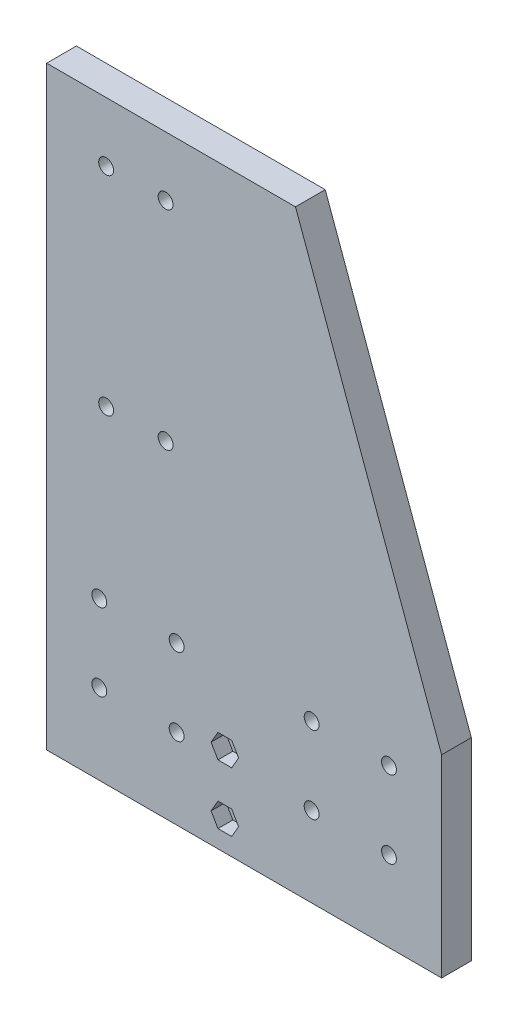
from build123d import *

# Parameters (mm, degrees)
SKETCH1_R           = 2.5
BOSS_EXTRUDE1_DEPTH = 10
CUT_EXTRUDE1_START  = 5
SKETCH1_3_R         = 2.5
CUT_EXTRUDE1_DEPTH  = 5
SKETCH4_R           = 2.5
CUT_EXTRUDE2_DEPTH  = 241.282833344


with BuildPart() as part:
    # Sketch1 → Boss-Extrude1 (new body)
    with BuildSketch(Plane.XY):
        Polygon((0, 200), (0, 0), (132.8, 0), (132.8, 65), (83.664018374, 200), align=None)
        with Locations((17.7, 27)):
            Circle(SKETCH1_R, mode=Mode.SUBTRACT)
        with Locations((43.7, 27)):
            Circle(SKETCH1_R, mode=Mode.SUBTRACT)
        with Locations((17.7, 53)):
            Circle(SKETCH1_R, mode=Mode.SUBTRACT)
        with Locations((43.7, 53)):
            Circle(SKETCH1_R, mode=Mode.SUBTRACT)
        with Locations((89.1, 27)):
            Circle(SKETCH1_R, mode=Mode.SUBTRACT)
        with Locations((115.1, 27)):
            Circle(SKETCH1_R, mode=Mode.SUBTRACT)
        with Locations((89.1, 53)):
            Circle(SKETCH1_R, mode=Mode.SUBTRACT)
        with Locations((115.1, 53)):
            Circle(SKETCH1_R, mode=Mode.SUBTRACT)
        with Locations((59.91, 9.92)):
            Circle(SKETCH1_R, mode=Mode.SUBTRACT)
        with Locations((59.91, 29.92)):
            Circle(SKETCH1_R, mode=Mode.SUBTRACT)
    extrude(amount=BOSS_EXTRUDE1_DEPTH)

    # Sketch1<3> → Cut-Extrude1 (cut)
    # profile 1 of 2: a face of its own
    with BuildSketch(Plane.XY.offset(CUT_EXTRUDE1_START)):
        Polygon((62.2225, 25.914632507), (64.535, 29.92), (62.2225, 33.925367493), (57.5975, 33.925367493), (55.285, 29.92), (57.5975, 25.914632507), align=None)
        with Locations((59.91, 29.92)):
            Circle(SKETCH1_3_R, mode=Mode.SUBTRACT)
    # profile 2 of 2: a face of its own
    with BuildSketch(Plane.XY.offset(CUT_EXTRUDE1_START)):
        Polygon((64.535, 9.92), (62.2225, 13.925367493), (57.5975, 13.925367493), (55.285, 9.92), (57.5975, 5.914632507), (62.2225, 5.914632507), align=None)
        with Locations((59.91, 9.92)):
            Circle(SKETCH1_3_R, mode=Mode.SUBTRACT)
    extrude(amount=CUT_EXTRUDE1_DEPTH, mode=Mode.SUBTRACT)

    # Sketch4 → Cut-Extrude2 (cut, through all)
    with BuildSketch(Plane(origin=(0, 0, 0), x_dir=(-1, 0, 0), z_dir=(0, 0, -1))):
        with Locations((-20, 180)):
            Circle(SKETCH4_R)
        with Locations((-40, 180)):
            Circle(SKETCH4_R)
        with Locations((-40, 110)):
            Circle(SKETCH4_R)
        with Locations((-20, 110)):
            Circle(SKETCH4_R)
    extrude(amount=-CUT_EXTRUDE2_DEPTH, mode=Mode.SUBTRACT)


solid = part.part
